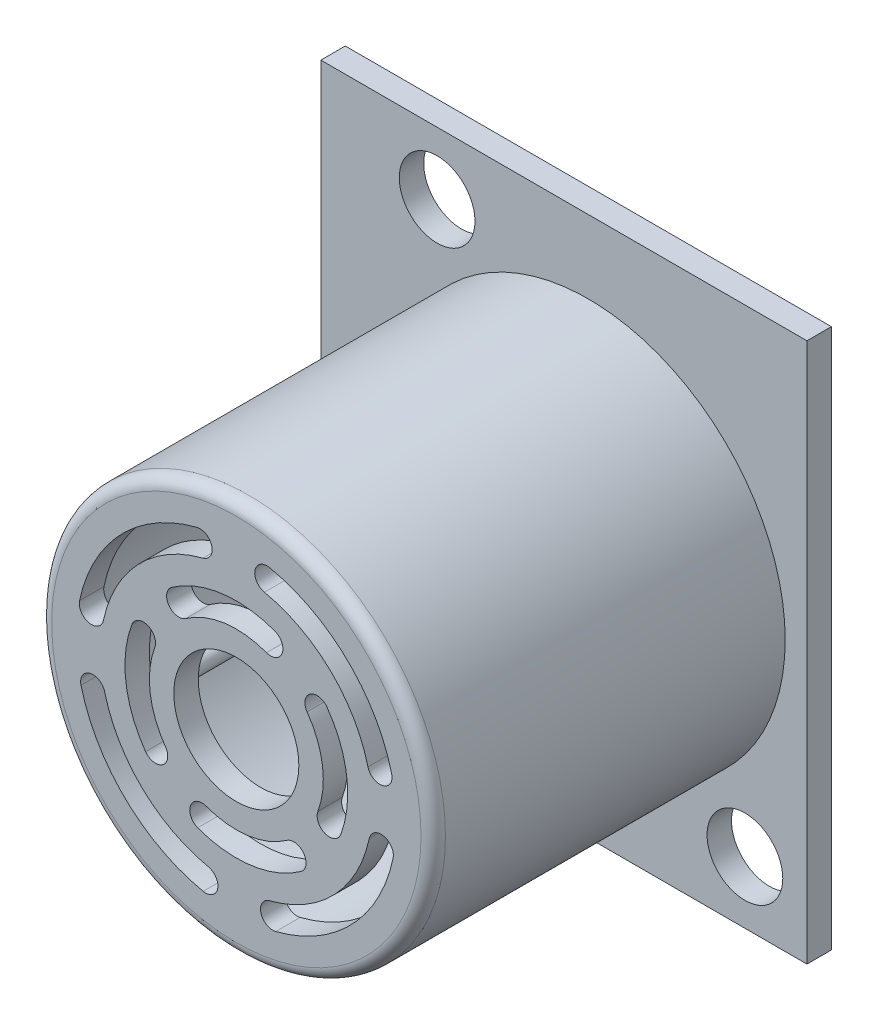
from build123d import *

# Parameters (mm, degrees)
SKETCH1_W         = 19.9
SKETCH1_H         = 22.1
EXTRUDE1_DEPTH    = 1
SKETCH2_R         = 1.55
EXTRUDE2_DEPTH    = 1
SKETCH3_R         = 8.06
EXTRUDE3_DEPTH    = 14.41
FILLET1_R         = 0.5
EXTRUDE4_DEPTH    = 14
SKETCH5_R         = 4.080248931
EXTRUDE5_DEPTH    = 6
SKETCH6_R         = 7.56
EXTRUDE6_DEPTH    = 1
SKETCH7_R         = 2.56
EXTRUDE7_DEPTH    = 1
CIRPATTERN1_COUNT = 4


with BuildPart() as part:
    # Sketch1 → Extrude1 (new body)
    with BuildSketch(Plane.XY):
        with Locations((9.95, -11.05)):
            Rectangle(SKETCH1_W, SKETCH1_H)
    extrude(amount=EXTRUDE1_DEPTH)

    # Sketch2 → Extrude2 (cut)
    with BuildSketch(Plane.XY.offset(1)):
        with Locations((4.76, -2.56)):
            Circle(SKETCH2_R)
        with Locations((17.36, -19.56)):
            Circle(SKETCH2_R)
    extrude(amount=-EXTRUDE2_DEPTH, mode=Mode.SUBTRACT)

    # Sketch3 → Extrude3 (add)
    with BuildSketch(Plane.XY.offset(1)):
        with Locations((10.95, -11.05)):
            Circle(SKETCH3_R)
    extrude(amount=EXTRUDE3_DEPTH)

    # Fillet1
    fillet1_edges = [part.edges().sort_by_distance(p)[0] for p in [
        (2.89, -11.05, 15.41),
    ]]
    fillet(fillet1_edges, radius=FILLET1_R)

    # Sketch4 → Extrude4 (cut)
    with BuildSketch(Plane.XY.offset(15.41)):
        with BuildLine():
            ThreePointArc((4.443587046, -14.89970005), (12.945634995, -18.341847569), (18.51, -11.05))
            ThreePointArc((18.51, -11.05), (9.328261839, -3.665992596), (4.085776366, -14.217969997))
            ThreePointArc((4.085776366, -14.217969997), (4.596973119, -14.384429603), (4.443587046, -14.89970005))
        make_face()
    extrude(amount=-EXTRUDE4_DEPTH, mode=Mode.SUBTRACT)

    # Sketch5 → Extrude5 (add)
    with BuildSketch(Plane.XY.offset(1.41)):
        with Locations((10.95, -11.05)):
            Circle(SKETCH5_R)
    extrude(amount=EXTRUDE5_DEPTH)

    # Sketch6 → Extrude6 (add)
    with BuildSketch(Plane.XY.offset(15.41)):
        with Locations((10.95, -11.05)):
            Circle(SKETCH6_R)
    extrude(amount=-EXTRUDE6_DEPTH)

    # Sketch7 → Extrude7 (cut)
    with BuildSketch(Plane.XY.offset(15.41)):
        with BuildLine():
            ThreePointArc((9.336018728, -4.691646089), (6.219061267, -6.505572786), (4.531903422, -9.692930984))
            ThreePointArc((4.531903422, -9.692930984), (4.917652474, -10.285550313), (5.510271803, -9.899801261))
            ThreePointArc((5.510271803, -9.899801261), (6.940240952, -7.198320837), (9.582052458, -5.660907356))
            ThreePointArc((9.582052458, -5.660907356), (9.943666227, -5.053259858), (9.336018728, -4.691646089))
        make_face()
        with BuildLine():
            ThreePointArc((7.610757875, -9.815876007), (7.315095216, -9.173549305), (6.672768514, -9.469211964))
            ThreePointArc((6.672768514, -9.469211964), (6.429833576, -11.651411253), (7.234902476, -13.694172911))
            ThreePointArc((7.234902476, -13.694172911), (7.929385865, -13.813614361), (8.053660071, -13.119979472))
            ThreePointArc((8.053660071, -13.119979472), (7.421559011, -11.522973767), (7.610757875, -9.815876007))
        make_face()
        with Locations((10.95, -11.05)):
            Circle(SKETCH7_R)
    extrude7 = extrude(amount=-EXTRUDE7_DEPTH, mode=Mode.SUBTRACT)

    # CirPattern1: Extrude7 ×4 about axis
    cirpattern1_axis = Axis((10.95, -11.05, 15.41), (0, 0, -1))
    for i in range(1, CIRPATTERN1_COUNT):
        add(extrude7.rotate(cirpattern1_axis, i * 360 / CIRPATTERN1_COUNT), mode=Mode.SUBTRACT)


solid = part.part
